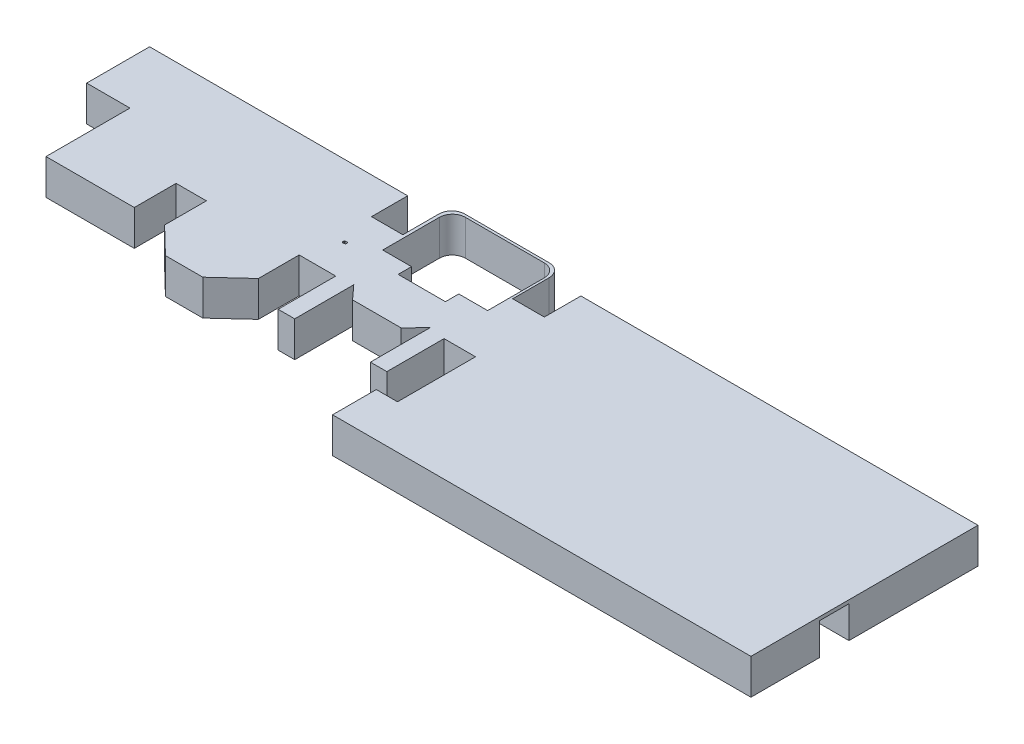
from build123d import *

# Parameters (mm, degrees)
BOSS_EXTRUDE1_DEPTH     = 4100
BOSS_EXTRUDE1_2_DEPTH   = 4100
BOSS_EXTRUDE1_3_DEPTH   = 4100
CUT_EXTRUDE2_DEPTH      = 100
CUT_EXTRUDE2_DEPTH_BACK = 1000
SKETCH8_W               = 4000
SKETCH8_H               = 1574.725224171
BOSS_EXTRUDE2_DEPTH     = 400
SKETCH10_W              = 4000
SKETCH10_H              = 1574.725224171
VENTANAS_DEPTH          = 150


with BuildPart() as part:
    # Sketch5 → Boss-Extrude1 (new body)
    with BuildSketch(Plane(origin=(0, 0, 0), x_dir=(1, 0, 0), z_dir=(0, 1, 0))):
        Polygon((-62854.969491775, 3032.5434193), (-92722.442891537, 3032.5434193), (-92722.442891537, -4248.037983208), (-87714.630252684, -4248.037983208), (-87714.630252684, -13961.448907134), (-77497.684007523, -13961.448907134), (-77497.684007523, -9120.831801635), (-73993.999245447, -9120.831801635), (-73993.999245447, -13961.448907134), (-70874.353647814, -16978.243851345), (-66551.436516177, -16978.243851345), (-63204.037171957, -13893.822161368), (-63204.037171957, -9177.535874451), (-58974.210587207, -9177.535874451), (-58974.210587207, -15834.789027484), (-57060.499737676, -15834.789027484), (-57060.499737676, -8999.658062996), (-55614.702387222, -10587.318993272), (-49997.826624289, -10587.318993272), (-48338.773974021, -8876.998824422), (-48338.773974021, -15794.435779887), (-46437.441187314, -15794.435779887), (-46437.441187314, -9177.535874451), (-42795.906953804, -9177.535874451), (-42795.906953804, -18201.935134033), (-45253.433289974, -18201.935134033), (-45253.433289974, -23262.658838668), (3158.957531363, -23262.658838668), (3158.957531363, -15328.601141736), (-37892.428555691, -15328.601141736), (-37892.428555691, -18201.935134033), (-35343.296365796, -18201.935134033), (-35343.296365796, -20101.017145526), (-40314.073819657, -20101.017145526), (-40314.073819657, -14936.195598619), (-42544.305578732, -14936.195598619), (-42544.305578732, -13384.460420479), (-40314.073819657, -13384.460420479), (-40314.073819657, -8605.216818302), (-48338.773974021, -8619.236312499), (-50136.470996543, -10373.327428628), (-55355.779342749, -10373.327428628), (-57060.499737676, -8626.228460954), (-63481.182206834, -8626.228460954), (-63481.182206834, -13591.968549095), (-66551.436516177, -16662.222858439), (-70681.043303792, -16662.222858439), (-73704.520388125, -13701.734880029), (-73704.520388125, -5657.434184393), (-69334.040082689, -5657.434184393), (-69334.040082689, -2723.974810711), (-77712.653607025, -2723.974810711), (-77712.653607025, -3732.516174556), (-79338.691811209, -3732.516174556), (-79338.691811209, -2716.242296941), (-82681.103675364, -2716.242296941), (-82681.103675364, -10733.513998125), (-84329.725743495, -10733.513998125), (-84329.725743495, -8904.221018418), (-87423.715104233, -8904.221018418), (-87423.715104233, -1043.502104908), (-65946.021432816, -1043.502104908), (-65946.021432816, -2698.193280669), (-66861.72431649, -2698.193280669), (-66861.72431649, -5660.11065383), (-62893.678487237, -5660.11065383), (-62893.678487237, -1541.515953923), (-61139.275030104, -1541.515953923), (-61139.275030104, -1153.615193648), (-62854.969491775, -1153.615193648), align=None)
    extrude(amount=BOSS_EXTRUDE1_DEPTH)


with BuildPart() as body_2:
    # Sketch5 → Boss-Extrude1 2 (new body)
    with BuildSketch(Plane(origin=(0, 0, 0), x_dir=(1, 0, 0), z_dir=(0, 1, 0))):
        Polygon((-12313.028333178, -11916.639751867), (3158.957531363, -11916.639751867), (3158.957531363, 3013.360006537), (-42795.906953804, 3013.360006537), (-42795.906953804, -1217.323428695), (-44543.949233842, -1217.323428695), (-44543.949233842, -1414.449774136), (-42795.906953804, -1414.449774136), (-42795.906953804, -5614.479565918), (-15610.034301318, -5614.479565918), (-15610.034301318, -1822.890132319), (-2613.500033243, -1822.890132319), (-2613.500033243, 969.647657109), (-646.027271848, 969.647657109), (-646.027271848, -9455.936692923), (-2613.500033243, -9455.936692923), (-2613.500033243, -5114.719474681), (-12313.028333178, -5114.719474681), align=None)
    extrude(amount=BOSS_EXTRUDE1_2_DEPTH)


with BuildPart() as body_3:
    # Sketch5 → Boss-Extrude1 3 (new body)
    with BuildSketch(Plane(origin=(0, 0, 0), x_dir=(1, 0, 0), z_dir=(0, 1, 0))):
        with BuildLine():
            Line((-59226.532602146, -4121.47924984), (-55960.882280047, -4121.47924984))
            Line((-55960.882280047, -4121.47924984), (-55960.882280047, -5665.367364151))
            Line((-55960.882280047, -5665.367364151), (-49725.652353067, -5665.367364151))
            Line((-49725.652353067, -5665.367364151), (-49725.652353067, -4121.47924984))
            Line((-49725.652353067, -4121.47924984), (-46460.002030968, -4121.47924984))
            Line((-46460.002030968, -4121.47924984), (-46460.002030968, 3008.349613089))
            ThreePointArc((-46460.002030968, 3008.349613089), (-46899.341859188, 4069.009784869), (-47960.002030968, 4508.349613089))
            Line((-47960.002030968, 4508.349613089), (-57726.532602146, 4508.349613089))
            ThreePointArc((-57726.532602146, 4508.349613089), (-58787.192773926, 4069.009784869), (-59226.532602146, 3008.349613089))
            Line((-59226.532602146, 3008.349613089), (-59226.532602146, -4121.47924984))
        make_face()
        with BuildLine():
            Line((-57364.018387913, 4213.781855253), (-48224.726051815, 4213.781855253))
            ThreePointArc((-48224.726051815, 4213.781855253), (-47164.065880035, 3774.442027033), (-46724.726051815, 2713.781855253))
            Line((-46724.726051815, 2713.781855253), (-46724.726051815, -3848.072569742))
            Line((-46724.726051815, -3848.072569742), (-50057.992785226, -3848.072569742))
            Line((-50057.992785226, -3848.072569742), (-50057.992785226, -5398.429189933))
            Line((-50057.992785226, -5398.429189933), (-55530.751654502, -5398.429189933))
            Line((-55530.751654502, -5398.429189933), (-55530.751654502, -3848.072569742))
            Line((-55530.751654502, -3848.072569742), (-58864.018387913, -3848.072569742))
            Line((-58864.018387913, -3848.072569742), (-58864.018387913, 2713.781855253))
            ThreePointArc((-58864.018387913, 2713.781855253), (-58424.678559693, 3774.442027033), (-57364.018387913, 4213.781855253))
        make_face(mode=Mode.SUBTRACT)
    extrude(amount=BOSS_EXTRUDE1_3_DEPTH)


with BuildPart() as cut_extrude2_tool:
    # Sketch8 → Cut-Extrude2 (new, two sides: drawn at the far end of the back side and taken through both)
    with BuildSketch(Plane(origin=(0, 0, -3022.951712918), x_dir=(-1, 0, 0), z_dir=(0, 0, -1)).offset(-CUT_EXTRUDE2_DEPTH_BACK)):
        with Locations((5231.252465647, 2315.293735901)):
            Rectangle(SKETCH8_W, SKETCH8_H)
        with Locations((-28.405935853, 2315.293735901)):
            Rectangle(SKETCH8_W, SKETCH8_H)
        with Locations((15815.636386773, 2315.293735901)):
            Rectangle(SKETCH8_W, SKETCH8_H)
        with Locations((10555.977985272, 2315.293735901)):
            Rectangle(SKETCH8_W, SKETCH8_H)
        with Locations((23763.886231613, 2315.293735901)):
            Rectangle(SKETCH8_W, SKETCH8_H)
        with Locations((39607.928554239, 2315.293735901)):
            Rectangle(SKETCH8_W, SKETCH8_H)
        with Locations((29023.544633113, 2315.293735901)):
            Rectangle(SKETCH8_W, SKETCH8_H)
        with Locations((34348.270152738, 2315.293735901)):
            Rectangle(SKETCH8_W, SKETCH8_H)
        with Locations((72871.270372947, 2315.293735901)):
            Rectangle(SKETCH8_W, SKETCH8_H)
        with Locations((83455.654294073, 2315.293735901)):
            Rectangle(SKETCH8_W, SKETCH8_H)
        with Locations((88715.312695573, 2315.293735901)):
            Rectangle(SKETCH8_W, SKETCH8_H)
        with Locations((78130.928774448, 2315.293735901)):
            Rectangle(SKETCH8_W, SKETCH8_H)
        with Locations((67598.858524863, 2315.293735901)):
            Rectangle(SKETCH8_W, SKETCH8_H)
    extrude(amount=CUT_EXTRUDE2_DEPTH + CUT_EXTRUDE2_DEPTH_BACK)


with BuildPart() as part_1:
    add(part.part)

    # Cut-Extrude2: cut by cut_extrude2_tool
    add(cut_extrude2_tool.part, mode=Mode.SUBTRACT)



with BuildPart() as body_2_1:
    add(body_2.part)

    # Cut-Extrude2: cut by cut_extrude2_tool
    add(cut_extrude2_tool.part, mode=Mode.SUBTRACT)


with BuildPart() as part_2:
    add(part_1.part)

    add(body_2_1.part)  # Boss-Extrude2 merges body 2

    add(body_3.part)  # Boss-Extrude2 merges body 3
    # Sketch11 → Boss-Extrude2 (add)
    with BuildSketch(Plane(origin=(0, 4100, 0), x_dir=(1, 0, 0), z_dir=(0, 1, 0))):
        Polygon((-62854.969491775, 3032.5434193), (-92722.442891537, 3032.5434193), (-92722.442891537, -4248.037983208), (-87714.630252684, -4248.037983208), (-87714.630252684, -13961.448907134), (-77497.684007523, -13961.448907134), (-77497.684007523, -9120.831801635), (-73993.999245447, -9120.831801635), (-73993.999245447, -13961.448907134), (-70874.353647814, -16978.243851345), (-66551.436516177, -16978.243851345), (-63204.037171957, -13893.822161368), (-63204.037171957, -9177.535874451), (-58974.210587207, -9177.535874451), (-58974.210587207, -15834.789027484), (-57060.499737676, -15834.789027484), (-57060.499737676, -8999.658062996), (-55614.702387222, -10587.318993272), (-49997.826624289, -10587.318993272), (-48338.773974021, -8876.998824422), (-48338.773974021, -15794.435779887), (-46437.441187314, -15794.435779887), (-46437.441187314, -9177.535874451), (-42795.906953804, -9177.535874451), (-42795.906953804, -18201.935134033), (-45253.433289974, -18201.935134033), (-45253.433289974, -23262.658838668), (3158.957531363, -23262.658838668), (3158.957531363, 3013.360006537), (-42795.906953804, 3013.360006537), (-42795.906953804, -1217.323428695), (-46460.002030968, -1217.323428695), (-46460.002030968, -4121.47924984), (-49725.652353067, -4121.47924984), (-49725.652353067, -5665.367364151), (-55960.882280047, -5665.367364151), (-55960.882280047, -4121.47924984), (-59226.532602146, -4121.47924984), (-59226.532602146, -1153.615193648), (-62854.969491775, -1153.615193648), align=None)
        with BuildLine():
            Line((-62020.014054855, -5388.888998251), (-62020.014054855, -5163.687596874))
            ThreePointArc((-62020.014054855, -5163.687596874), (-62005.369393914, -5128.332257815), (-61970.014054855, -5113.687596874))
            Line((-61970.014054855, -5113.687596874), (-61662.078613853, -5113.687596874))
            ThreePointArc((-61662.078613853, -5113.687596874), (-61626.723274794, -5128.332257815), (-61612.078613853, -5163.687596874))
            Line((-61612.078613853, -5163.687596874), (-61612.078613853, -5388.888998251))
            Line((-61612.078613853, -5388.888998251), (-61719.175469751, -5388.888998251))
            Line((-61719.175469751, -5388.888998251), (-61719.175469751, -5437.542435503))
            Line((-61719.175469751, -5437.542435503), (-61911.509537571, -5437.542435503))
            Line((-61911.509537571, -5437.542435503), (-61911.509537571, -5388.888998251))
            Line((-61911.509537571, -5388.888998251), (-62020.014054855, -5388.888998251))
        make_face(mode=Mode.SUBTRACT)
    extrude(amount=-BOSS_EXTRUDE2_DEPTH)

    # Sketch10 → Ventanas (add)
    with BuildSketch(Plane(origin=(0, 0, -3022.951712918), x_dir=(-1, 0, 0), z_dir=(0, 0, -1))):
        with Locations((5231.252465647, 2315.293735901)):
            Rectangle(SKETCH10_W, SKETCH10_H)
        with Locations((-28.405935853, 2315.293735901)):
            Rectangle(SKETCH10_W, SKETCH10_H)
        with Locations((15815.636386773, 2315.293735901)):
            Rectangle(SKETCH10_W, SKETCH10_H)
        with Locations((10555.977985272, 2315.293735901)):
            Rectangle(SKETCH10_W, SKETCH10_H)
        with Locations((23763.886231613, 2315.293735901)):
            Rectangle(SKETCH10_W, SKETCH10_H)
        with Locations((39607.928554239, 2315.293735901)):
            Rectangle(SKETCH10_W, SKETCH10_H)
        with Locations((29023.544633113, 2315.293735901)):
            Rectangle(SKETCH10_W, SKETCH10_H)
        with Locations((34348.270152738, 2315.293735901)):
            Rectangle(SKETCH10_W, SKETCH10_H)
        with Locations((72871.270372947, 2315.293735901)):
            Rectangle(SKETCH10_W, SKETCH10_H)
        with Locations((83455.654294073, 2315.293735901)):
            Rectangle(SKETCH10_W, SKETCH10_H)
        with Locations((88715.312695573, 2315.293735901)):
            Rectangle(SKETCH10_W, SKETCH10_H)
        with Locations((78130.928774448, 2315.293735901)):
            Rectangle(SKETCH10_W, SKETCH10_H)
        with Locations((67598.858524863, 2315.293735901)):
            Rectangle(SKETCH10_W, SKETCH10_H)
    extrude(amount=-VENTANAS_DEPTH)


solid = part_2.part
